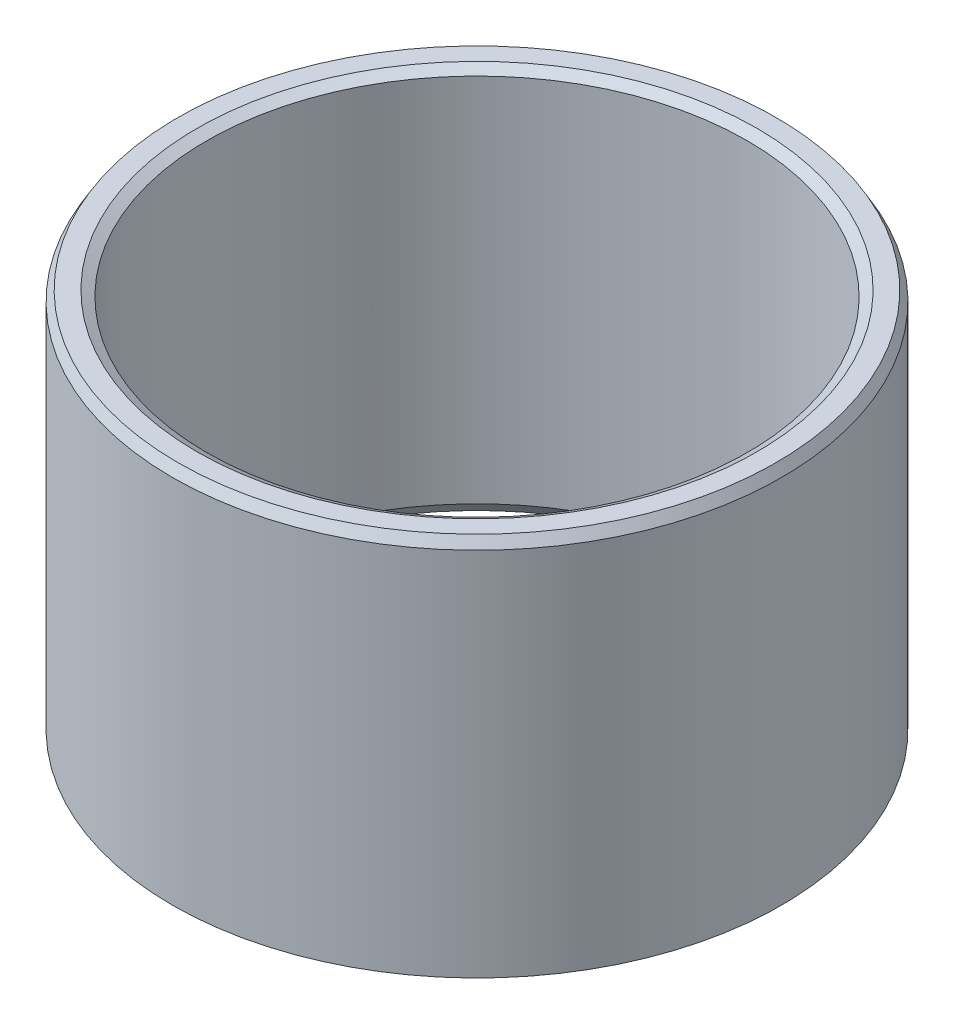
from build123d import *
from OCP.BRepFilletAPI import BRepFilletAPI_MakeChamfer

# Parameters (mm, degrees)
SKETCH1_R           = 52.5
BOSS_EXTRUDE1_DEPTH = 66.510551102
SKETCH2_R           = 46.553450288
CUT_EXTRUDE1_DEPTH  = 100.680255858
CHAMFER1_SIZE       = 1.703848849
CHAMFER1_SIZE2      = 0.983717592


with BuildPart() as part:
    # Sketch1 → Boss-Extrude1 (new body)
    with BuildSketch(Plane(origin=(0, 0, 0), x_dir=(1, 0, 0), z_dir=(0, 1, 0))):
        Circle(SKETCH1_R)
    extrude(amount=BOSS_EXTRUDE1_DEPTH)

    # Sketch2 → Cut-Extrude1 (cut, through all)
    with BuildSketch(Plane(origin=(0, 0, 0), x_dir=(1, 0, 0), z_dir=(0, 1, 0))):
        Circle(SKETCH2_R)
    extrude(amount=CUT_EXTRUDE1_DEPTH, mode=Mode.SUBTRACT)

    # Chamfer1: one chamfer whose edges measure the first distance from different faces: ONE call of the kernel's chamfer builder (chamfer() names one face for all edges)
    chamfer1_edges_1 = [part.edges().sort_by_distance(p)[0] for p in [
        (-46.553450288, 66.510551102, 0),
    ]]
    chamfer1_side_1 = [part.faces().sort_by_distance(p)[0] for p in [
        (-51.01507576, 66.510551102, 0),
    ]]
    chamfer1_edges_2 = [part.edges().sort_by_distance(p)[0] for p in [
        (-46.553450288, 0, 0),
    ]]
    chamfer1_side_2 = [part.faces().sort_by_distance(p)[0] for p in [
        (-46.553450288, 33.255275551, 0),
    ]]
    chamfer1_edges_3 = [part.edges().sort_by_distance(p)[0] for p in [
        (-52.5, 0, 0),
    ]]
    chamfer1_side_3 = [part.faces().sort_by_distance(p)[0] for p in [
        (-51.01507576, 0, 0),
    ]]
    chamfer1_edges_4 = [part.edges().sort_by_distance(p)[0] for p in [
        (-52.5, 66.510551102, 0),
    ]]
    chamfer1_side_4 = [part.faces().sort_by_distance(p)[0] for p in [
        (-52.5, 33.255275551, 0),
    ]]
    chamfer1 = BRepFilletAPI_MakeChamfer(part.part.solid().wrapped)
    for e in chamfer1_edges_1:
        chamfer1.Add(CHAMFER1_SIZE, CHAMFER1_SIZE2, e.wrapped, chamfer1_side_1[0].wrapped)  # the first distance lies on this face
    for e in chamfer1_edges_2:
        chamfer1.Add(CHAMFER1_SIZE, CHAMFER1_SIZE2, e.wrapped, chamfer1_side_2[0].wrapped)  # the first distance lies on this face
    for e in chamfer1_edges_3:
        chamfer1.Add(CHAMFER1_SIZE, CHAMFER1_SIZE2, e.wrapped, chamfer1_side_3[0].wrapped)  # the first distance lies on this face
    for e in chamfer1_edges_4:
        chamfer1.Add(CHAMFER1_SIZE, CHAMFER1_SIZE2, e.wrapped, chamfer1_side_4[0].wrapped)  # the first distance lies on this face
    add(Compound.cast(chamfer1.Shape()), mode=Mode.REPLACE)


solid = part.part
